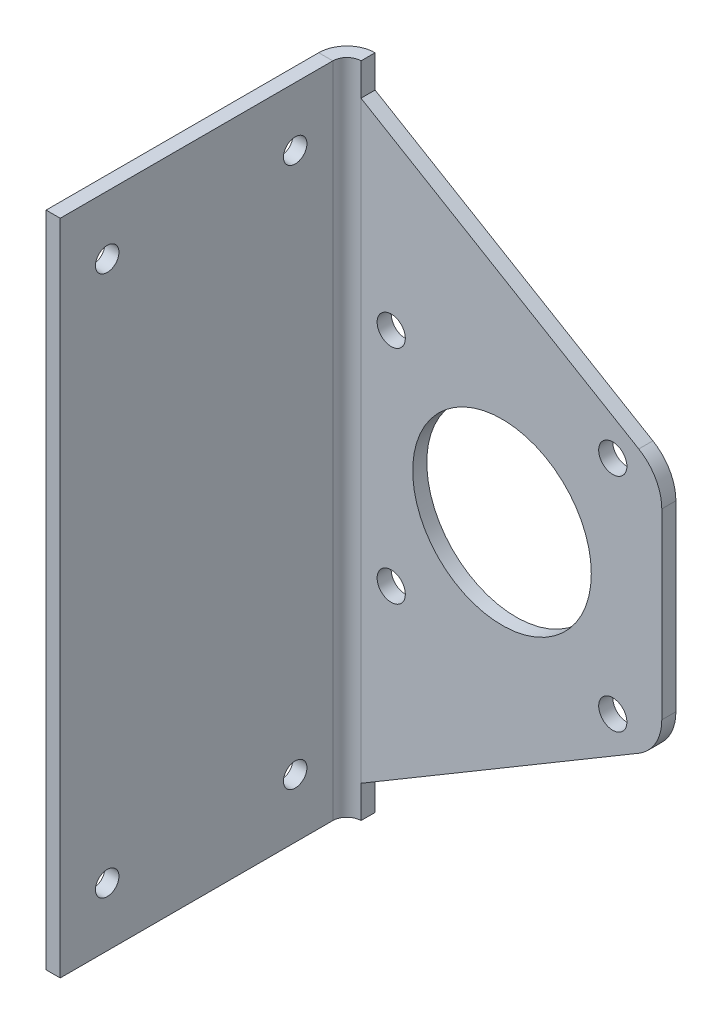
from build123d import *

# Parameters (mm, degrees)
SKETCH1_W                    = 70
SKETCH1_H                    = 3
BASE_FLANGE1_DEPTH           = 140
EDGE_FLANGE1_STRIP_W         = 18
EDGE_FLANGE1_STRIP_H         = 3
EDGE_FLANGE1_STRIP_CUT_DEPTH = 140
EDGE_FLANGE1_DEPTH           = 140
SKETCH9_R                    = 19
SKETCH9_R_2                  = 3
CUT_EXTRUDE1_DEPTH           = 10
SKETCH10_R                   = 2.5
CUT_EXTRUDE2_DEPTH           = 10
SKETCH11_R                   = 2.5
CUT_EXTRUDE3_DEPTH           = 3
CUT_EXTRUDE4_DEPTH           = 10
FILLET1_R                    = 10
FILLET2_R                    = 10


# Sheet-metal steps are written as plain solids
with BuildPart() as part:
    # Sketch1 → Base-Flange1 (new body)
    with BuildSketch(Plane(origin=(0, 0, 0), x_dir=(1, 0, 0), z_dir=(0, 1, 0))):
        with Locations((0, -1.5)):
            Rectangle(SKETCH1_W, SKETCH1_H)
    extrude(amount=BASE_FLANGE1_DEPTH)

    # Edge-Flange1 strip (across the edge) → Edge-Flange1 strip cut (cut)
    with BuildSketch(Plane(origin=(-35, 140, 3), x_dir=(1, 0, 0), z_dir=(0, -1, 0))):
        with Locations((-3, -1.5)):
            Rectangle(EDGE_FLANGE1_STRIP_W, EDGE_FLANGE1_STRIP_H)
    extrude(amount=EDGE_FLANGE1_STRIP_CUT_DEPTH, mode=Mode.SUBTRACT)

    # Edge-Flange1 section (across the edge) → Edge-Flange1 (add)
    with BuildSketch(Plane(origin=(-35, 140, 3), x_dir=(1, 0, 0), z_dir=(0, -1, 0))):
        with BuildLine():
            Line((0, 3), (0, 61))
            Line((0, 61), (3, 61))
            Line((3, 61), (3, 3))
            ThreePointArc((3, 3), (3.878679656, 0.878679656), (6, 0))
            Line((6, 0), (6, -3))
            ThreePointArc((6, -3), (1.757359313, -1.242640687), (0, 3))
        make_face()
    extrude(amount=EDGE_FLANGE1_DEPTH)

    # Sketch9 → Cut-Extrude1 (cut)
    with BuildSketch(Plane.XY.offset(3)):
        with Locations((1, 70)):
            Circle(SKETCH9_R)
        with Locations((-22.57, 93.57)):
            Circle(SKETCH9_R_2)
        with Locations((24.57, 93.57)):
            Circle(SKETCH9_R_2)
        with Locations((24.57, 46.43)):
            Circle(SKETCH9_R_2)
        with Locations((-22.57, 46.43)):
            Circle(SKETCH9_R_2)
    extrude(amount=-CUT_EXTRUDE1_DEPTH, mode=Mode.SUBTRACT)

    # Sketch10 → Cut-Extrude2 (cut)
    with BuildSketch(Plane(origin=(-32, 0, 0), x_dir=(0, 0, -1), z_dir=(1, 0, 0))):
        with Locations((-54, 127.5)):
            Circle(SKETCH10_R)
        with Locations((-14, 127.5)):
            Circle(SKETCH10_R)
        with Locations((-14, 12.5)):
            Circle(SKETCH10_R)
        with Locations((-54, 12.5)):
            Circle(SKETCH10_R)
    extrude(amount=-CUT_EXTRUDE2_DEPTH, mode=Mode.SUBTRACT)

    # Sketch11 → Cut-Extrude3 (cut)
    with BuildSketch(Plane.XY.offset(3)):
        with Locations((0, 120)):
            Circle(SKETCH11_R)
        with Locations((0, 20)):
            Circle(SKETCH11_R)
    extrude(amount=-CUT_EXTRUDE3_DEPTH, mode=Mode.SUBTRACT)

    # Sketch12 → Cut-Extrude4 (cut)
    with BuildSketch(Plane(origin=(0, 0, 0), x_dir=(-1, 0, 0), z_dir=(0, 0, -1))):
        Polygon((-35, 95.130192279), (-35, 140), (29, 140), (29, 133.118302038), align=None)
        Polygon((29, 0), (29, 6.881697962), (-35, 44.869807721), (-35, 0), align=None)
    extrude(amount=-CUT_EXTRUDE4_DEPTH, mode=Mode.SUBTRACT)

    # Fillet1
    fillet1_edges = [part.edges().sort_by_distance(p)[0] for p in [
        (35, 44.869807721, 1.5),
    ]]
    fillet(fillet1_edges, radius=FILLET1_R)

    # Fillet2
    fillet2_edges = [part.edges().sort_by_distance(p)[0] for p in [
        (35, 95.130192279, 1.5),
    ]]
    fillet(fillet2_edges, radius=FILLET2_R)


solid = part.part
